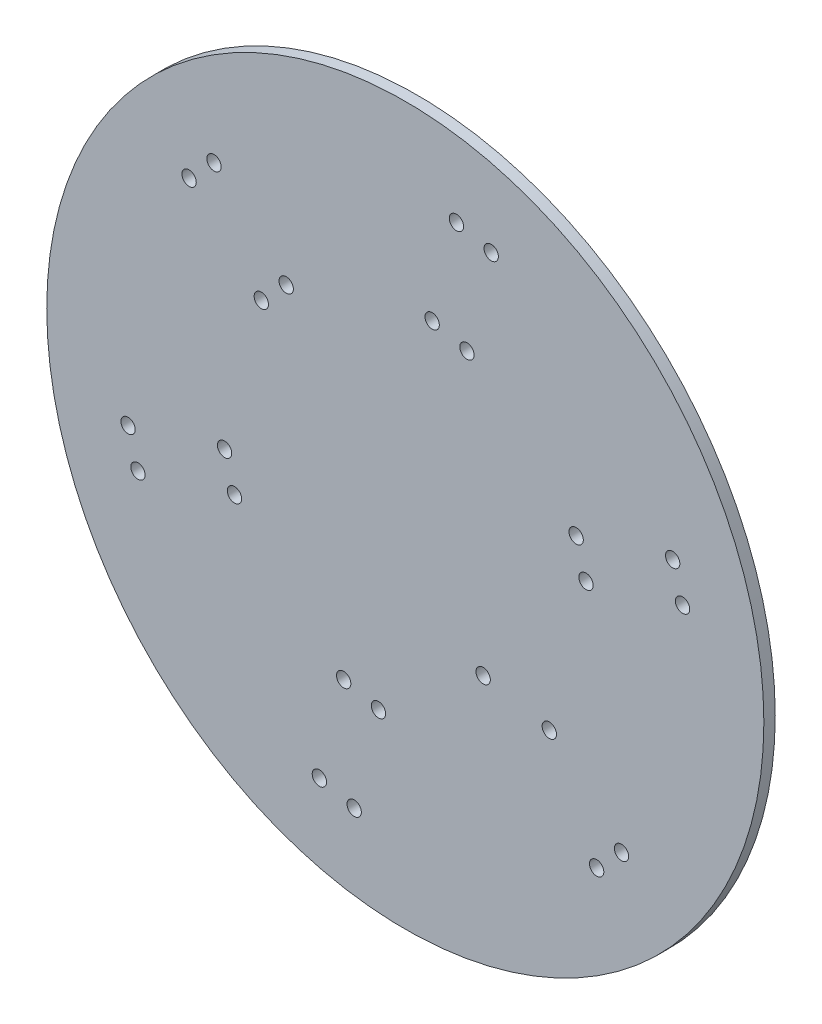
from build123d import *

# Parameters (mm, degrees)
SKETCH1_R           = 100
BOSS_EXTRUDE1_DEPTH = 3.175
SKETCH6_R           = 2
CUT_EXTRUDE1_DEPTH  = 142.456992139


with BuildPart() as part:
    # Sketch1 → Boss-Extrude1 (new body)
    with BuildSketch(Plane.XY):
        Circle(SKETCH1_R)
    extrude(amount=BOSS_EXTRUDE1_DEPTH)

    # Sketch6 → Cut-Extrude1 (cut, through all)
    with BuildSketch(Plane.XY.offset(3.175)):
        with Locations((-14.259072306, -77.863206054)):
            Circle(SKETCH6_R)
        with Locations((-23.9620693, -75.444146458)):
            Circle(SKETCH6_R)
        with Locations((-7.485705439, -50.694814469)):
            Circle(SKETCH6_R)
        with Locations((-17.188702433, -48.275754874)):
            Circle(SKETCH6_R)
        with Locations((60.30197831, -51.280321878)):
            Circle(SKETCH6_R)
        with Locations((53.35551275, -58.473833971)):
            Circle(SKETCH6_R)
        with Locations((21.706133595, -27.876828536)):
            Circle(SKETCH6_R)
        with Locations((40.160144451, -31.83021831)):
            Circle(SKETCH6_R)
        with Locations((77.31758205, 16.970312488)):
            Circle(SKETCH6_R)
        with Locations((74.561050616, 26.582884175)):
            Circle(SKETCH6_R)
        with Locations((47.64584989, 18.864596159)):
            Circle(SKETCH6_R)
        with Locations((50.402381324, 9.252024472)):
            Circle(SKETCH6_R)
        with Locations((23.9620693, 75.444146458)):
            Circle(SKETCH6_R)
        with Locations((14.259072306, 77.863206054)):
            Circle(SKETCH6_R)
        with Locations((7.485705439, 50.694814469)):
            Circle(SKETCH6_R)
        with Locations((17.188702433, 48.275754874)):
            Circle(SKETCH6_R)
        with Locations((-33.213678891, 39.023730402)):
            Circle(SKETCH6_R)
        with Locations((-40.160144451, 31.83021831)):
            Circle(SKETCH6_R)
        with Locations((-60.30197831, 51.280321878)):
            Circle(SKETCH6_R)
        with Locations((-53.35551275, 58.473833971)):
            Circle(SKETCH6_R)
        with Locations((-47.64584989, -18.864596159)):
            Circle(SKETCH6_R)
        with Locations((-50.402381324, -9.252024472)):
            Circle(SKETCH6_R)
        with Locations((-74.561050616, -26.582884175)):
            Circle(SKETCH6_R)
        with Locations((-77.31758205, -16.970312488)):
            Circle(SKETCH6_R)
    extrude(amount=-CUT_EXTRUDE1_DEPTH, mode=Mode.SUBTRACT)


solid = part.part
